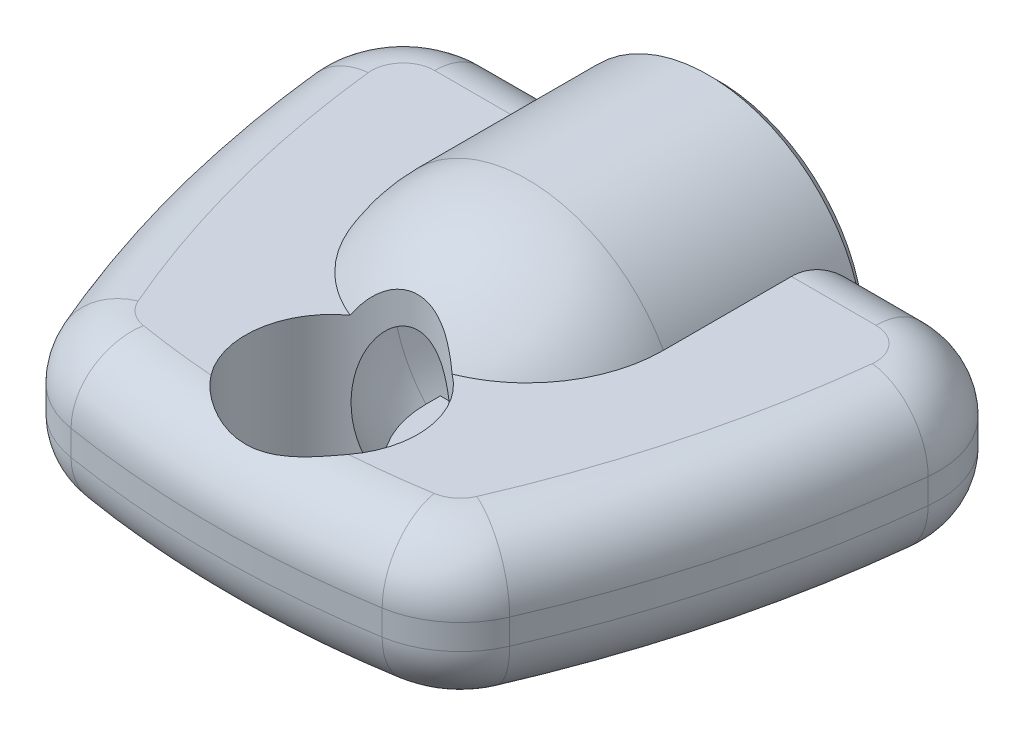
from build123d import *

# Parameters (mm, degrees)
BOSS_EXTRUDE1_DEPTH      = 12
BOSS_EXTRUDE1_DEPTH_BACK = 12
FILLET1_R                = 10
BOSS_EXTRUDE2_REACH      = 83.915
CUT_EXTRUDE1_DEPTH       = 98.519690427
CUT_EXTRUDE1_DEPTH_BACK  = 98.519690427
SKETCH5_R                = 13.665152344
CHAMFER1_SIZE            = 8
CHAMFER2_SIZE            = 1.6


with BuildPart() as part:
    # Sketch1 → Boss-Extrude1 (new, two sides: drawn at the far end of the back side and taken through both)
    with BuildSketch(Plane(origin=(0, 0, 0), x_dir=(1, 0, 0), z_dir=(0, 1, 0)).offset(-BOSS_EXTRUDE1_DEPTH_BACK)):
        with BuildLine():
            Line((-35, 0), (35, 0))
            ThreePointArc((35, 0), (46.17246087, -4.991197968), (49.909726541, -16.643184251))
            ThreePointArc((49.909726541, -16.643184251), (44.926099942, -43.406027638), (36.03300946, -69.135373954))
            ThreePointArc((36.03300946, -69.135373954), (31.487933236, -75.020695994), (24.674822271, -78))
            ThreePointArc((24.674822271, -78), (0, -80), (-24.674822271, -78))
            ThreePointArc((-24.674822271, -78), (-31.487933236, -75.020695994), (-36.03300946, -69.135373954))
            ThreePointArc((-36.03300946, -69.135373954), (-44.926099942, -43.406027638), (-49.909726541, -16.643184251))
            ThreePointArc((-49.909726541, -16.643184251), (-46.17246087, -4.991197968), (-35, 0))
        make_face()
    extrude(amount=BOSS_EXTRUDE1_DEPTH + BOSS_EXTRUDE1_DEPTH_BACK)

    # Fillet1
    fillet1_edges = [part.edges().sort_by_distance(p)[0] for p in [
        (-46.17246087, -12, 4.991197968),
        (-44.926099942, -12, 43.406027638),
        (-31.487933236, -12, 75.020695994),
        (46.17246087, 12, 4.991197968),
        (0, 12, 0),
        (-46.17246087, 12, 4.991197968),
        (-44.926099942, 12, 43.406027638),
        (-31.487933236, 12, 75.020695994),
        (0, -12, 80),
        (0, 12, 80),
        (31.487933236, 12, 75.020695994),
        (44.926099942, 12, 43.406027638),
        (31.487933236, -12, 75.020695994),
        (44.926099942, -12, 43.406027638),
        (46.17246087, -12, 4.991197968),
        (0, -12, 0),
    ]]
    fillet(fillet1_edges, radius=FILLET1_R)

    # Sketch2 → Revolve1 (revolve)
    with BuildSketch(Plane(origin=(0, 0, 0), x_dir=(1, 0, 0), z_dir=(0, 1, 0))):
        with BuildLine():
            Line((0, 0), (0, -55))
            ThreePointArc((0, -55), (17.465537495, -47.765537495), (24.7, -30.3))
            Line((24.7, -30.3), (24.7, 0))
            Line((24.7, 0), (0, 0))
        make_face()
    revolve(axis=Axis((0, 0, 0), (0, 0, 1)))

    # Sketch3 → Cut-Revolve1 (revolve, cut)
    with BuildSketch(Plane(origin=(0, 0, 0), x_dir=(1, 0, 0), z_dir=(0, 1, 0))):
        with BuildLine():
            Line((21.5, 0), (21.5, -30.3))
            ThreePointArc((21.5, -30.3), (15.202795796, -45.502795796), (0, -51.8))
            Line((0, -51.8), (0, 0))
            Line((0, 0), (21.5, 0))
        make_face()
    revolve(axis=Axis((0, 0, 0), (0, 0, 1)), mode=Mode.SUBTRACT)

    # Sketch4 → Boss-Extrude2 (add, up to next)
    with BuildSketch(Plane(origin=(0, 0, 20), x_dir=(-1, 0, 0), z_dir=(0, 0, -1)), mode=Mode.PRIVATE) as boss_extrude2_sk1:
        with BuildLine():
            Line((-16.099301227, 14.25), (16.099301227, 14.25))
            ThreePointArc((16.099301227, 14.25), (0, 21.5), (-16.099301227, 14.25))
        make_face()
    boss_extrude2_tool1 = extrude(boss_extrude2_sk1.sketch, amount=-BOSS_EXTRUDE2_REACH, mode=Mode.PRIVATE) - part.part
    # Sketch4 → Boss-Extrude2 (add, up to next)
    with BuildSketch(Plane(origin=(0, 0, 20), x_dir=(-1, 0, 0), z_dir=(0, 0, -1)), mode=Mode.PRIVATE) as boss_extrude2_sk2:
        with BuildLine():
            Line((-16.099301227, -14.25), (16.099301227, -14.25))
            ThreePointArc((16.099301227, -14.25), (0, -21.5), (-16.099301227, -14.25))
        make_face()
    boss_extrude2_tool2 = extrude(boss_extrude2_sk2.sketch, amount=-BOSS_EXTRUDE2_REACH, mode=Mode.PRIVATE) - part.part
    add(boss_extrude2_tool1.solids().sort_by_distance((0, 17.196475, 20))[0])
    add(boss_extrude2_tool2.solids().sort_by_distance((0, -17.196475, 20))[0])

    # Sketch5 → Cut-Extrude1 (cut, two sides: drawn at the far end of the back side and taken through both)
    with BuildSketch(Plane(origin=(0, 0, 0), x_dir=(1, 0, 0), z_dir=(0, 1, 0)).offset(-CUT_EXTRUDE1_DEPTH_BACK)):
        with Locations(Location((0, -61.334847656, 0), (0, 0, 322.861585756))):
            Circle(SKETCH5_R)
    extrude(amount=CUT_EXTRUDE1_DEPTH + CUT_EXTRUDE1_DEPTH_BACK, mode=Mode.SUBTRACT)

    # Chamfer1
    # the kernel refuses this chamfer: 8 mm, written as the material it takes off along each edge
    with BuildSketch(Plane(origin=(36.672765131, 14.25, 20), x_dir=(0, -0.02749587661058627, 0.9996219169112968), z_dir=(-1, 0, 0))) as chamfer1_piece_1_section:
        Polygon((CHAMFER1_SIZE * 0.999621916911, CHAMFER1_SIZE * 0.0274958766106), (-CHAMFER1_SIZE * 0.0274958766106, CHAMFER1_SIZE * 0.999621916911), (0, 0), align=None)
    chamfer1_piece_1 = extrude(amount=73.345530262, mode=Mode.PRIVATE)
    chamfer1_piece_1 = chamfer1_piece_1 & Plane(origin=(0, 0, 22.88602407), x_dir=(1, 0, 0), z_dir=(0, 0, 1)) * Cylinder(21.5, 179, mode=Mode.PRIVATE)
    add(chamfer1_piece_1, mode=Mode.SUBTRACT)
    with BuildSketch(Plane(origin=(36.672765131, -14.25, 20), x_dir=(0, 0.02749587661058627, 0.9996219169112968), z_dir=(-1, 0, 0))) as chamfer1_piece_2_section:
        Polygon((CHAMFER1_SIZE * 0.999621916911, -CHAMFER1_SIZE * 0.0274958766106), (-CHAMFER1_SIZE * 0.0274958766106, -CHAMFER1_SIZE * 0.999621916911), (0, 0), align=None)
    chamfer1_piece_2 = extrude(amount=73.345530262, mode=Mode.PRIVATE)
    chamfer1_piece_2 = chamfer1_piece_2 & Plane(origin=(0, 0, 22.88602407), x_dir=(1, 0, 0), z_dir=(0, 0, 1)) * Cylinder(21.5, 179, mode=Mode.PRIVATE)
    add(chamfer1_piece_2, mode=Mode.SUBTRACT)

    # Chamfer2
    chamfer2_edges = [part.edges().sort_by_distance(p)[0] for p in [
        (0, 24.7, 0),
        (0, -24.7, 0),
    ]]
    chamfer(chamfer2_edges, length=CHAMFER2_SIZE)


solid = part.part
